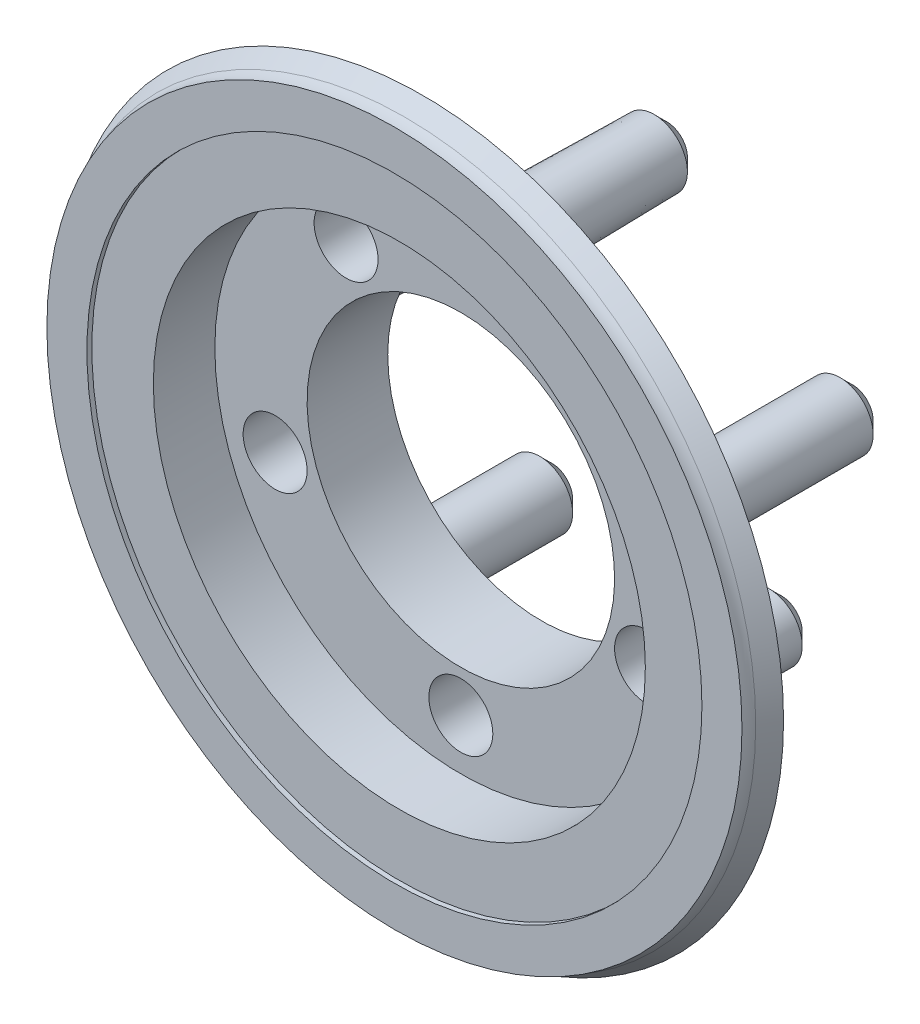
from build123d import *
from build123d.topology import SkipClean

# Parameters (mm, degrees)
SKETCH_10_R             = 2.675
EXTRUDE_5_DEPTH         = 17.5
CHAMFER1_SIZE           = 1
CHAMFER1_SIZE2          = 1.017920191
SKETCH_4_R              = 12.5
CUT_EXTRUDE_1_DEPTH     = 44.106650761
HOLE_WIZARD_M5_1_D      = 5.2
CIRPATTERN1_START       = -7.186794992
CIRPATTERN1_5_OUTLINE_R = 2.6
CIRPATTERN1_5_DEPTH     = 11.431671907
SKETCH_14_W             = 5
SKETCH_14_H             = 20
BOSS_EXTRUDE1_START     = 0.4
SKETCH1_R               = 28.255495976
SKETCH1_R_2             = 20
BOSS_EXTRUDE1_DEPTH     = 0.4
SKETCH4_R               = 25
CUT_EXTRUDE3_DEPTH      = 0.4
FILLET1_R               = 2


# Read off the part's stored shape, not the designer's step: 구배1, CirPattern1
with BuildPart() as part:
    # 스케치7 → 회전2 (revolve)
    with BuildSketch(Plane.ZY, mode=Mode.PRIVATE) as revolve_2_sk:
        with BuildLine():
            ThreePointArc((2.354808499, 29.346727485), (0.845544662, 25.810608837), (0, 22.06))
            Line((0, 22.06), (4.244876915, 22.06))
            Line((4.244876915, 22.06), (4.244876915, 28.255495976))
            Line((4.244876915, 28.255495976), (2.354808499, 29.346727485))
        make_face()
        with BuildLine():
            Line((-7.405123085, 11), (-7.405123085, 0))
            Line((-7.405123085, 0), (4.244876915, 0))
            Line((4.244876915, 0), (4.244876915, 22.06))
            Line((4.244876915, 22.06), (0, 22.06))
            ThreePointArc((0, 22.06), (-5.382911125, 17.655062883), (-7.405123085, 11))
        make_face()
    revolve(revolve_2_sk.sketch.rotate(Axis((0, 0, -7.405123085), (0, 0, 1)), 90), axis=Axis((0, 0, -7.405123085), (0, 0, 1)))

    # 스케치10 → 보스-돌출5 (add)
    with BuildSketch(Plane.XY):
        with Locations((0, 15.875)):
            Circle(SKETCH_10_R)
    extrude(amount=-EXTRUDE_5_DEPTH)

    # 구배1 outline → 구배1 (revolve)
    with BuildSketch(Plane.XZ.offset(-15.875)):
        Polygon((2.675, -17.5), (2.901355148, -4.532122261), (2.675, -4.532122261), align=None)
    revolve(axis=Axis((0, 15.875, 0), (0, 0, 1)))

    # Chamfer1
    chamfer1_edges = [part.edges().sort_by_distance(p)[0] for p in [
        (-2.675, 15.875, -17.5),
    ]]
    chamfer1_side = [part.faces().sort_by_distance(p)[0] for p in [
        (0, 15.875, -17.5),
    ]]
    chamfer(chamfer1_edges, length=CHAMFER1_SIZE, length2=CHAMFER1_SIZE2, reference=chamfer1_side[0])

    # 스케치4 → 컷-돌출1 (cut, through all)
    with BuildSketch(Plane(origin=(0, 0, -7.405123085), x_dir=(-1, 0, 0), z_dir=(0, 0, -1))):
        with Locations(Location((0, 0, 0), (0, 0, 90))):
            Circle(SKETCH_4_R)
    extrude(amount=-CUT_EXTRUDE_1_DEPTH, mode=Mode.SUBTRACT)

    # M5 나선 코일용 탭 드릴1 (through all)
    with Locations(Plane.XY.offset(4.244876915)):
        with Locations((0, -15.875)):
            Hole(HOLE_WIZARD_M5_1_D / 2)

    # CirPattern1 outline → CirPattern1 (revolve)
    with BuildSketch(Plane(origin=(15.098022196, 4.905644786, 0), x_dir=(1, 0, 0), z_dir=(0, -1, 0))):
        Polygon((0, -4.72112791), (0, -17.5), (1.675, -17.5), (2.675, -16.5), (2.675, -4.72112791), align=None)
    revolve(axis=Axis((15.098022196, 4.905644786, 0), (0, 0, 1)))

    # CirPattern1 2 outline → CirPattern1 2 (revolve)
    with BuildSketch(Plane(origin=(9.33109088, -12.843144786, 0), x_dir=(1, 0, 0), z_dir=(0, -1, 0))):
        Polygon((0, -4.721045305), (0, -17.5), (1.675, -17.5), (2.675, -16.5), (2.675, -4.721045305), align=None)
    revolve(axis=Axis((9.33109088, -12.843144786, 0), (0, 0, 1)))

    # CirPattern1 3 outline → CirPattern1 3 (revolve)
    with BuildSketch(Plane(origin=(-9.33109088, -12.843144786, 0), x_dir=(1, 0, 0), z_dir=(0, -1, 0))):
        Polygon((0, -4.72095341), (0, -17.5), (1.675, -17.5), (2.675, -16.5), (2.675, -4.72095341), align=None)
    revolve(axis=Axis((-9.33109088, -12.843144786, 0), (0, 0, 1)))

    # CirPattern1 4 outline → CirPattern1 4 (revolve)
    with BuildSketch(Plane(origin=(-15.098022196, 4.905644786, 0), x_dir=(1, 0, 0), z_dir=(0, -1, 0))):
        Polygon((0, -4.721296369), (0, -17.5), (1.675, -17.5), (2.675, -16.5), (2.675, -4.721296369), align=None)
    revolve(axis=Axis((-15.098022196, 4.905644786, 0), (0, 0, 1)))

    # CirPattern1 5 outline → CirPattern1 5 (cut)
    with BuildSketch(Plane.XY.offset(CIRPATTERN1_START)):
        with Locations((-15.098022196, -4.905644786)):
            Circle(CIRPATTERN1_5_OUTLINE_R)
        with Locations((-9.33109088, 12.843144786)):
            Circle(CIRPATTERN1_5_OUTLINE_R)
        with Locations((9.33109088, 12.843144786)):
            Circle(CIRPATTERN1_5_OUTLINE_R)
        with Locations((15.098022196, -4.905644786)):
            Circle(CIRPATTERN1_5_OUTLINE_R)
    extrude(amount=CIRPATTERN1_5_DEPTH, mode=Mode.SUBTRACT)

    # 스케치14 → 컷-회전1 (revolve, cut)
    with BuildSketch(Plane(origin=(0, 0, 0), x_dir=(0, 0, -1), z_dir=(1, 0, 0))):
        with Locations((-1.744876915, 10)):
            Rectangle(SKETCH_14_W, SKETCH_14_H)
    revolve(axis=Axis((0, 0, 4.244876915), (0, 0, -1)), mode=Mode.SUBTRACT)

    # Sketch1 → Boss-Extrude1 (add)
    with SkipClean():  # the faces are left unmerged after this step: merging them gives an invalid solid
        with BuildSketch(Plane.XY.offset(4.244876915).offset(BOSS_EXTRUDE1_START)):
            Circle(SKETCH1_R)
            Circle(SKETCH1_R_2, mode=Mode.SUBTRACT)
        extrude(amount=-BOSS_EXTRUDE1_DEPTH)

    # Sketch4 → Cut-Extrude3 (cut)
    with BuildSketch(Plane.XY.offset(4.644876915)):
        Circle(SKETCH4_R)
    extrude(amount=-CUT_EXTRUDE3_DEPTH, mode=Mode.SUBTRACT)

    # Fillet1
    # the kernel refuses this fillet: 2 mm, written as the material it adds along each edge
    with BuildSketch(Plane(origin=(0, 0, 4.244876915), x_dir=(-1, 0, 0), z_dir=(0, 1, 0))) as fillet1_piece_1:
        with BuildLine():
            CenterArc((30.250231597, 0.545016556), FILLET1_R, 184.158067237, 25.841932763)
            Line((28.518180789, -0.454983444), (28.483539773, -0.474983444))
            Line((28.483539773, -0.474983444), (28.22085496, -0.02))
            Line((28.22085496, -0.02), (28.215495976, 0))
            ThreePointArc((28.215495976, 0), (28.215495976, 0.2), (28.215601263, 0.397099669))
            Line((28.215601263, 0.397099669), (28.255495976, 0.4))
        make_face()
    revolve(axis=Axis((0, 0, 4.244876915), (0, 0, 1)), revolution_arc=180)
    with BuildSketch(Plane(origin=(0, 0, 4.244876915), x_dir=(1, 0, 0), z_dir=(0, -1, 0))) as fillet1_piece_2:
        with BuildLine():
            CenterArc((30.250231597, 0.545016556), FILLET1_R, 184.158067237, 25.841932763)
            Line((28.518180789, -0.454983444), (28.483539773, -0.474983444))
            Line((28.483539773, -0.474983444), (28.22085496, -0.02))
            Line((28.22085496, -0.02), (28.215495976, 0))
            ThreePointArc((28.215495976, 0), (28.215495976, 0.2), (28.215601263, 0.397099669))
            Line((28.215601263, 0.397099669), (28.255495976, 0.4))
        make_face()
    revolve(axis=Axis((0, 0, 4.244876915), (0, 0, 1)), revolution_arc=180)


solid = part.part
